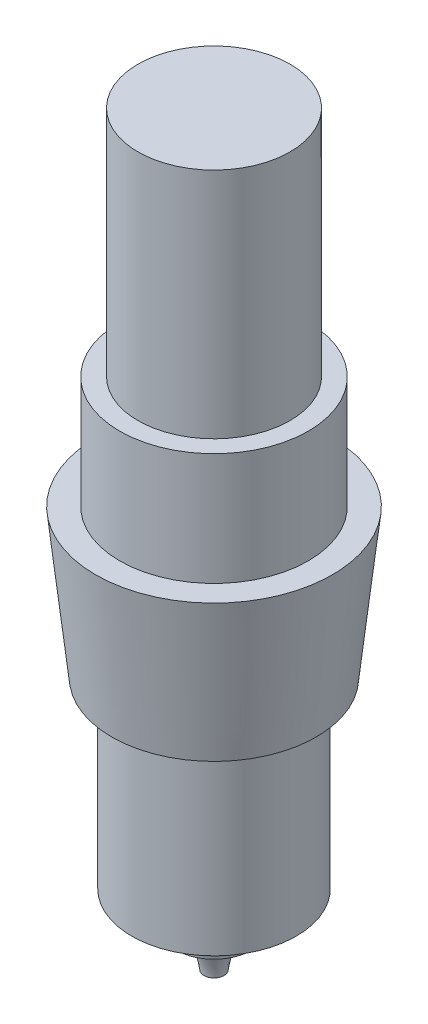
from build123d import *

# Parameters (mm, degrees)
SKETCH1_R           = 18.95
BOSS_EXTRUDE1_DEPTH = 58
SKETCH2_R           = 23.5
BOSS_EXTRUDE2_DEPTH = 28
SKETCH3_R           = 29.5
SKETCH4_R           = 25.5
SKETCH6_R           = 20.5
BOSS_EXTRUDE3_DEPTH = 45.5


with BuildPart() as part:
    # Sketch1 → Boss-Extrude1 (new body)
    with BuildSketch(Plane(origin=(0, 0, 0), x_dir=(1, 0, 0), z_dir=(0, 1, 0))):
        with Locations(Location((0, 0, 0), (0, 0, 90))):
            Circle(SKETCH1_R)
    extrude(amount=BOSS_EXTRUDE1_DEPTH)

    # Sketch2 → Boss-Extrude2 (add)
    with BuildSketch(Plane.XZ):
        with Locations(Location((0, 0, 0), (0, 0, 270))):
            Circle(SKETCH2_R)
    extrude(amount=BOSS_EXTRUDE2_DEPTH)

    # Sketch3 → Loft1 section 0
    with BuildSketch(Plane.XZ.offset(28)):
        Circle(SKETCH3_R)
    # Sketch4 → Loft1 section 1
    with BuildSketch(Plane(origin=(0, -65, 0), x_dir=(-1, 0, 0), z_dir=(0, -1, 0))):
        Circle(SKETCH4_R)
    loft()

    # Sketch6 → Boss-Extrude3 (add)
    with BuildSketch(Plane.XZ.offset(65)):
        with Locations(Location((0, 0, 0), (0, 0, 270))):
            Circle(SKETCH6_R)
    extrude(amount=BOSS_EXTRUDE3_DEPTH)

    # Loft2: read off the stored shape, not the designer's step
    # Loft2: loft between two sections, ruled curve by curve
    loft2_from = [
        Edge.make_bspline([(19.32271694, -110.5, -6.847087705), (33.01689235, -110.5, 31.798346176), (-5.628541531, -110.5, 45.492521586), (-19.32271694, -110.5, 6.847087705), (-33.01689235, -110.5, -31.798346176), (5.628541531, -110.5, -45.492521586), (19.32271694, -110.5, -6.847087705)], [0, 0, 0, 0, 0.5, 0.5, 0.5, 1, 1, 1, 1], 3, [1, 0.333333333, 0.333333333, 1, 0.333333333, 0.333333333, 1]),
    ]
    loft2_to = [
        Edge.make_bspline([(6.801396589, -119, 6.63257148), (-6.463746372, -119, 20.235364658), (-20.06653955, -119, 6.970221697), (-6.801396589, -119, -6.63257148), (6.463746372, -119, -20.235364658), (20.06653955, -119, -6.970221697), (6.801396589, -119, 6.63257148)], [0, 0, 0, 0, 0.5, 0.5, 0.5, 1, 1, 1, 1], 3, [1, 0.333333333, 0.333333333, 1, 0.333333333, 0.333333333, 1]),
    ]
    loft2 = Solid(Shell([*[Face.make_surface_from_curves(loft2_from[k], loft2_to[k]) for k in range(1)], Face(Wire(loft2_from)), Face(Wire(loft2_to))]))
    add(loft2)

    # Loft5: read off the stored shape, not the designer's step
    # Loft5: loft between two sections, ruled curve by curve
    loft5_from = [
        Edge.make_bspline([(-4.99352595, -119, -0.254359166), (-4.484807619, -119, -10.241411066), (5.502244282, -119, -9.732692735), (4.99352595, -119, 0.254359166), (4.484807619, -119, 10.241411066), (-5.502244282, -119, 9.732692735), (-4.99352595, -119, -0.254359166)], [0, 0, 0, 0, 0.5, 0.5, 0.5, 1, 1, 1, 1], 3, [1, 0.333333333, 0.333333333, 1, 0.333333333, 0.333333333, 1]),
    ]
    loft5_to = [
        Edge.make_bspline([(-1.785448857, -128, 1.749906392), (-5.28526164, -128, -1.820991321), (-1.714363927, -128, -5.320804105), (1.785448857, -128, -1.749906392), (5.28526164, -128, 1.820991321), (1.714363927, -128, 5.320804105), (-1.785448857, -128, 1.749906392)], [0, 0, 0, 0, 0.5, 0.5, 0.5, 1, 1, 1, 1], 3, [1, 0.333333333, 0.333333333, 1, 0.333333333, 0.333333333, 1]),
    ]
    loft5 = Solid(Shell([*[Face.make_surface_from_curves(loft5_from[k], loft5_to[k]) for k in range(1)], Face(Wire(loft5_from)), Face(Wire(loft5_to))]))
    add(loft5)


solid = part.part
